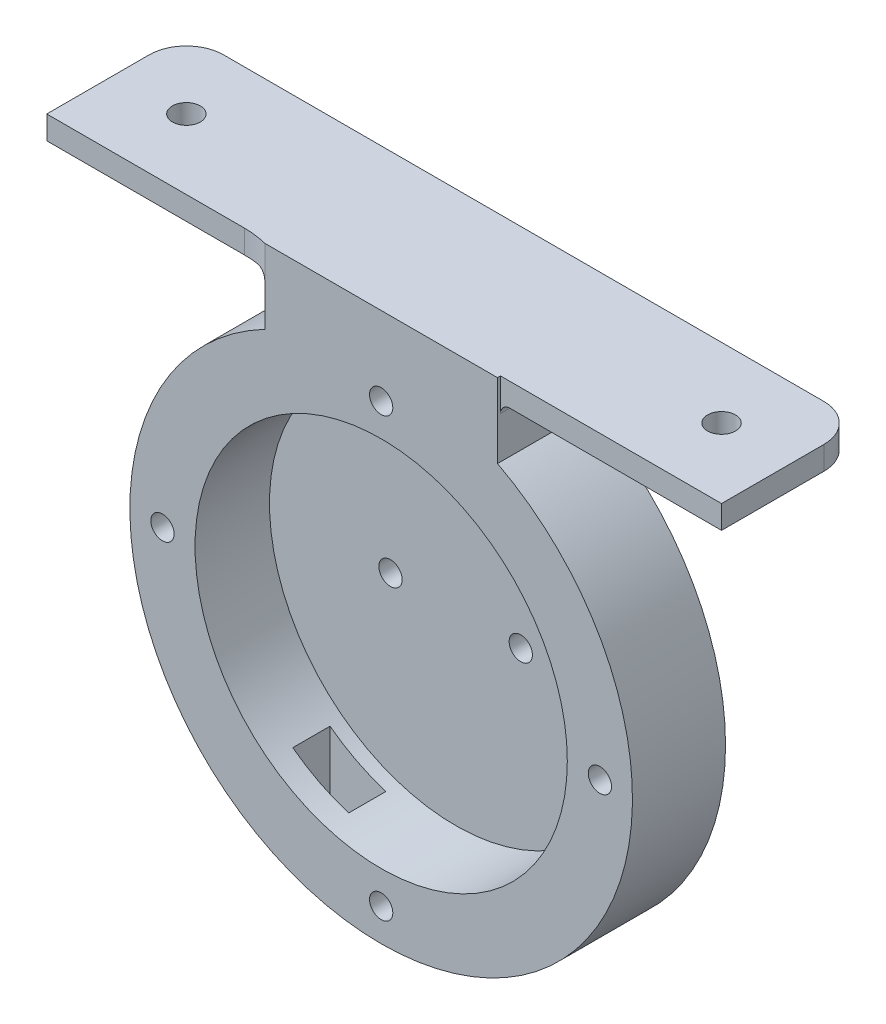
from build123d import *

# Parameters (mm, degrees)
SKETCH1_R               = 27
SKETCH1_R_2             = 1.25
SKETCH1_R_3             = 20
BOSS_EXTRUDE1_DEPTH     = 10
SKETCH3_R               = 20
SKETCH3_R_2             = 1.25
BOSS_EXTRUDE2_DEPTH     = 2
BOSS_EXTRUDE3_DEPTH     = 6
CUT_EXTRUDE1_REACH      = 44.996
CUT_EXTRUDE1_END_RADIUS = 27
SKETCH4_W               = 6
SKETCH4_H               = 4
SKETCH6_W               = 25
SKETCH6_H               = 15.32
BOSS_EXTRUDE4_DEPTH     = 2.5
SKETCH7_R               = 1.5
BOSS_EXTRUDE5_DEPTH     = 2.5
FILLET2_R               = 10
FILLET3_R               = 1


with BuildPart() as part:
    # Sketch1 → Boss-Extrude1 (new body)
    with BuildSketch(Plane.XY):
        Circle(SKETCH1_R)
        with Locations((0, 23.5)):
            Circle(SKETCH1_R_2, mode=Mode.SUBTRACT)
        with Locations((23.5, 0)):
            Circle(SKETCH1_R_2, mode=Mode.SUBTRACT)
        with Locations((0, -23.5)):
            Circle(SKETCH1_R_2, mode=Mode.SUBTRACT)
        with Locations((-23.5, 0)):
            Circle(SKETCH1_R_2, mode=Mode.SUBTRACT)
        Circle(SKETCH1_R_3, mode=Mode.SUBTRACT)
    extrude(amount=BOSS_EXTRUDE1_DEPTH)

    # Sketch3 → Boss-Extrude2 (add)
    with BuildSketch(Plane.XY):
        Circle(SKETCH3_R)
        with Locations((-7, 0)):
            Circle(SKETCH3_R_2, mode=Mode.SUBTRACT)
        with Locations((7, 0)):
            Circle(SKETCH3_R_2, mode=Mode.SUBTRACT)
    extrude(amount=BOSS_EXTRUDE2_DEPTH)

    # Sketch5 → Boss-Extrude3 (add)
    with BuildSketch(Plane.XY.offset(10)):
        Polygon((-12.5, 23.932195888), (-4.251935746, 23.932195888), (0, 26.25446737), (4.267780323, 23.932195888), (12.5, 23.932195888), (12.5, 31.932195888), (-12.5, 31.932195888), align=None)
    extrude(amount=-BOSS_EXTRUDE3_DEPTH)

    # Cut-Extrude1: up to this cylinder (the profile starts inside it)
    cut_extrude1_end = Plane(origin=(0, 0, 5.5), z_dir=(0, 0, -1)) * Cylinder(CUT_EXTRUDE1_END_RADIUS, 144.992, mode=Mode.PRIVATE)
    # Sketch4 → Cut-Extrude1 (cut, up to the surface)
    with BuildSketch(Plane(origin=(0, 0, 0), x_dir=(1, 0, 0), z_dir=(0, 1, 0)), mode=Mode.PRIVATE) as cut_extrude1_sk1:
        with Locations((-9, -5.5)):
            Rectangle(SKETCH4_W, SKETCH4_H)
    cut_extrude1_tool1 = extrude(cut_extrude1_sk1.sketch, amount=-CUT_EXTRUDE1_REACH, mode=Mode.PRIVATE) & cut_extrude1_end
    add(cut_extrude1_tool1.solids().sort_by_distance((-9, 0, 5.5))[0], mode=Mode.SUBTRACT)

    # Sketch6 → Boss-Extrude4 (add)
    with BuildSketch(Plane(origin=(0, 31.932195888, 0), x_dir=(1, 0, 0), z_dir=(0, 1, 0))):
        with Locations((0, -2.34)):
            Rectangle(SKETCH6_W, SKETCH6_H)
    boss_extrude4 = extrude(amount=-BOSS_EXTRUDE4_DEPTH)

    # Sketch7 → Boss-Extrude5 (add)
    with BuildSketch(Plane(origin=(0, 31.932195888, 0), x_dir=(1, 0, 0), z_dir=(0, 1, 0))):
        with BuildLine():
            Line((-36.25, -9.68), (-28.75, -9.68))
            Line((-28.75, -9.68), (0, -9.68))
            Line((0, -9.68), (0, 5.32))
            Line((0, 5.32), (-32.25, 5.32))
            ThreePointArc((-32.25, 5.32), (-35.078427125, 4.148427125), (-36.25, 1.32))
            Line((-36.25, 1.32), (-36.25, -2.18))
            Line((-36.25, -2.18), (-36.25, -9.68))
        make_face()
        with Locations(Location((-28.75, -2.18, 0), (0, 0, 270))):
            Circle(SKETCH7_R, mode=Mode.SUBTRACT)
    boss_extrude5 = extrude(amount=-BOSS_EXTRUDE5_DEPTH)

    # Fillet2
    # the kernel refuses this fillet: 10 mm, written as the material it adds along each edge
    with BuildSketch(Plane(origin=(-12.5, 29.432195888, 9.68), x_dir=(-1, 0, 0), z_dir=(0, 1, 0))) as fillet2_piece_1:
        with BuildLine():
            CenterArc((2.509501943, 10), FILLET2_R, 255.466253099, 14.533746901)
            Line((0, 0.32), (-0.050190039, 0.1264))
            ThreePointArc((-0.050190039, 0.1264), (-0.2, 0.16), (-0.2, 0))
            Line((-0.2, 0), (0, -0.2))
            Line((0, -0.2), (2.509501943, -0.2))
            Line((2.509501943, -0.2), (2.509501943, 0))
        make_face()
    extrude(amount=2.5)

    # Mirror1: Boss-Extrude4, Boss-Extrude5 across plane
    add(boss_extrude4.mirror(Plane(origin=(0, 0, 0), x_dir=(0, 0, 1), z_dir=(1, 0, 0))))
    add(boss_extrude5.mirror(Plane(origin=(0, 0, 0), x_dir=(0, 0, 1), z_dir=(1, 0, 0))))

    # Fillet3
    # the kernel refuses this fillet: 1 mm, written as the material it adds along each edge
    with BuildSketch(Plane(origin=(-12.5, 29.432195888, 4), x_dir=(0, -1, 0), z_dir=(0, 0, 1))) as fillet3_piece_1_section:
        with BuildLine():
            CenterArc((FILLET3_R, -FILLET3_R), FILLET3_R, 90, 90)
            Line((0, -FILLET3_R), (0, 0))
            Line((0, 0), (FILLET3_R, 0))
        make_face()
    fillet3_piece_1 = extrude(amount=6, mode=Mode.PRIVATE)
    fillet3_piece_1 = fillet3_piece_1 - Plane(origin=(-15.009501943, 29.204760134, 19.68), x_dir=(-1, 0, 0), z_dir=(0, -1, 0)) * Cylinder(10, 16, mode=Mode.PRIVATE)
    add(fillet3_piece_1)
    with BuildSketch(Plane(origin=(12.5, 29.432195888, 9.68), x_dir=(0, -1, 0), z_dir=(0, 0, -1))) as fillet3_piece_2:
        with BuildLine():
            CenterArc((FILLET3_R, -FILLET3_R), FILLET3_R, 90, 90)
            Line((0, -FILLET3_R), (0, 0))
            Line((0, 0), (FILLET3_R, 0))
        make_face()
    extrude(amount=5.68)
    with BuildSketch(Plane(origin=(12.5, 29.432195888, 4), x_dir=(0, -1, 0), z_dir=(-1, 0, 0))) as fillet3_piece_3:
        with BuildLine():
            CenterArc((FILLET3_R, -FILLET3_R), FILLET3_R, 90, 90)
            Line((0, -FILLET3_R), (0, 0))
            Line((0, 0), (FILLET3_R, 0))
        make_face()
    extrude(amount=25)
    with BuildSketch(Plane(origin=(-12.5, 29.432195888, 1.5), x_dir=(0, -1, 0), z_dir=(0, 0, 1))) as fillet3_piece_4a_section:
        with BuildLine():
            CenterArc((FILLET3_R, -FILLET3_R), FILLET3_R, 90, 90)
            Line((0, -FILLET3_R), (0, 0))
            Line((0, 0), (FILLET3_R, 0))
        make_face()
    fillet3_piece_4a = extrude(amount=8.5, mode=Mode.PRIVATE)
    fillet3_piece_4a = split(fillet3_piece_4a, bisect_by=Plane(origin=(-12.726395114, 29.205800773, 4), z_dir=(0, 0, -1)), keep=Keep.TOP, mode=Mode.PRIVATE)
    with BuildSketch(Plane(origin=(12.5, 29.432195888, 4), x_dir=(0, -1, 0), z_dir=(-1, 0, 0))) as fillet3_piece_4b_section:
        with BuildLine():
            CenterArc((FILLET3_R, -FILLET3_R), FILLET3_R, 90, 90)
            Line((0, -FILLET3_R), (0, 0))
            Line((0, 0), (FILLET3_R, 0))
        make_face()
    fillet3_piece_4b = extrude(amount=27.5, mode=Mode.PRIVATE)
    fillet3_piece_4b = split(fillet3_piece_4b, bisect_by=Plane(origin=(-12.5, 29.205800773, 3.773604886), z_dir=(-1, 0, 0)), keep=Keep.TOP, mode=Mode.PRIVATE)
    fillet3_piece_4 = fillet3_piece_4a & fillet3_piece_4b
    add(fillet3_piece_4)
    with BuildSketch(Plane(origin=(12.5, 29.432195888, 9.68), x_dir=(0, -1, 0), z_dir=(0, 0, -1))) as fillet3_piece_5a_section:
        with BuildLine():
            CenterArc((FILLET3_R, -FILLET3_R), FILLET3_R, 90, 90)
            Line((0, -FILLET3_R), (0, 0))
            Line((0, 0), (FILLET3_R, 0))
        make_face()
    fillet3_piece_5a = extrude(amount=8.18, mode=Mode.PRIVATE)
    fillet3_piece_5a = split(fillet3_piece_5a, bisect_by=Plane(origin=(12.726395114, 29.205800773, 4), z_dir=(0, 0, -1)), keep=Keep.TOP, mode=Mode.PRIVATE)
    with BuildSketch(Plane(origin=(15, 29.432195888, 4), x_dir=(0, -1, 0), z_dir=(-1, 0, 0))) as fillet3_piece_5b_section:
        with BuildLine():
            CenterArc((FILLET3_R, -FILLET3_R), FILLET3_R, 90, 90)
            Line((0, -FILLET3_R), (0, 0))
            Line((0, 0), (FILLET3_R, 0))
        make_face()
    fillet3_piece_5b = extrude(amount=27.5, mode=Mode.PRIVATE)
    fillet3_piece_5b = split(fillet3_piece_5b, bisect_by=Plane(origin=(12.5, 29.205800773, 3.773604886), z_dir=(1, 0, 0)), keep=Keep.TOP, mode=Mode.PRIVATE)
    fillet3_piece_5 = fillet3_piece_5a & fillet3_piece_5b
    add(fillet3_piece_5)


solid = part.part
